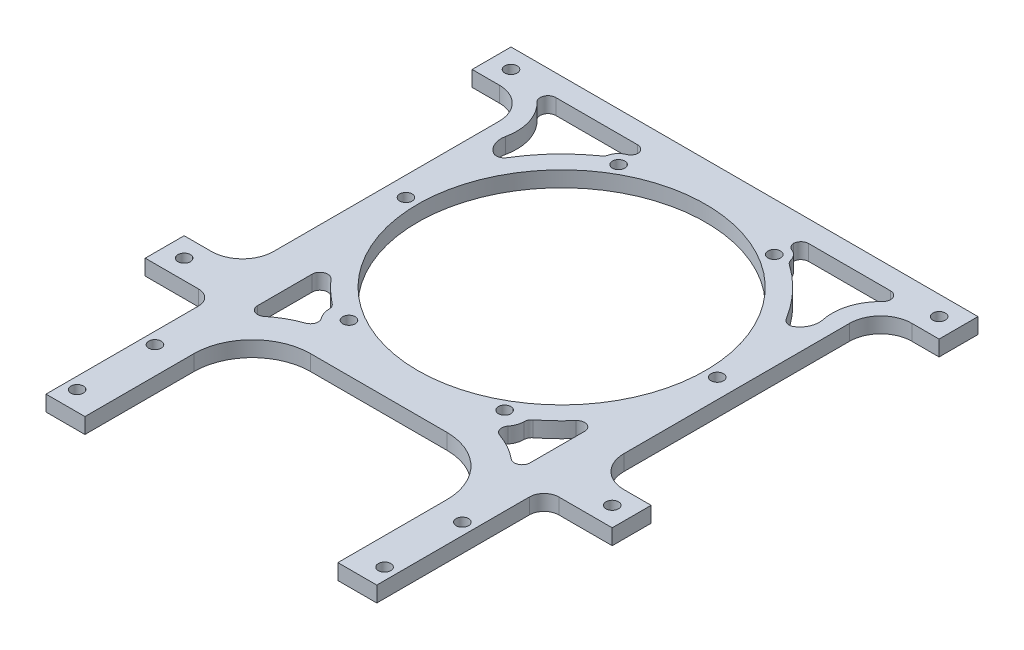
from build123d import *

# Parameters (mm, degrees)
SKETCH_1_W          = 120
SKETCH_1_H          = 94
SKETCH_1_R          = 37
EXTRUDE_2_DEPTH     = 4
SKETCH_2_W          = 15
SKETCH_2_H          = 74
CUT_EXTRUDE_1_DEPTH = 10
FILLET_1_R          = 8
FILLET_2_R          = 8
SKETCH_5_R          = 1.6
CUT_EXTRUDE_2_DEPTH = 10
SKETCH_6_W          = 10
SKETCH_6_H          = 43
EXTRUDE_3_DEPTH     = 4
FILLET_3_R          = 3.8
FILLET_4_R          = 15
SKETCH_7_R          = 1.6
CUT_EXTRUDE_3_DEPTH = 109.240473022
CUT_EXTRUDE_4_DEPTH = 10
FILLET_5_DEPTH      = 4
FILLET_6_R          = 5
MIRROR_1_DEPTH      = 4
SKETCH_10_R         = 1.6
CUT_EXTRUDE_6_DEPTH = 109.240473022


with BuildPart() as part:
    # 草图1 → 凸台-拉伸2 (new body)
    with BuildSketch(Plane(origin=(0, 0, 0), x_dir=(1, 0, 0), z_dir=(0, 1, 0))):
        Rectangle(SKETCH_1_W, SKETCH_1_H)
        with Locations(Location((0, 0, 0), (0, 0, 270))):
            Circle(SKETCH_1_R, mode=Mode.SUBTRACT)
    extrude(amount=EXTRUDE_2_DEPTH)

    # 草图2 → 切除-拉伸1 (cut)
    with BuildSketch(Plane(origin=(0, 4, 0), x_dir=(1, 0, 0), z_dir=(0, 1, 0))):
        with Locations((-52.5, 0)):
            Rectangle(SKETCH_2_W, SKETCH_2_H)
        with Locations((52.5, 0)):
            Rectangle(SKETCH_2_W, SKETCH_2_H)
    extrude(amount=-CUT_EXTRUDE_1_DEPTH, mode=Mode.SUBTRACT)

    # 圆角1
    fillet_1_edges = [part.edges().sort_by_distance(p)[0] for p in [
        (-45, 2, -37),
        (45, 2, -37),
    ]]
    fillet(fillet_1_edges, radius=FILLET_1_R)

    # 圆角2
    fillet_2_edges = [part.edges().sort_by_distance(p)[0] for p in [
        (-45, 2, 37),
        (45, 2, 37),
    ]]
    fillet(fillet_2_edges, radius=FILLET_2_R)

    # 草图5 → 切除-拉伸2 (cut)
    with BuildSketch(Plane(origin=(0, 4, 0), x_dir=(1, 0, 0), z_dir=(0, 1, 0))):
        with Locations(Location((-55, 42, 0), (0, 0, 270))):
            Circle(SKETCH_5_R)
        with Locations(Location((-55, -42, 0), (0, 0, 270))):
            Circle(SKETCH_5_R)
        with Locations(Location((55, -42, 0), (0, 0, 270))):
            Circle(SKETCH_5_R)
        with Locations(Location((55, 42, 0), (0, 0, 270))):
            Circle(SKETCH_5_R)
    extrude(amount=-CUT_EXTRUDE_2_DEPTH, mode=Mode.SUBTRACT)

    # 草图6 → 凸台-拉伸3 (add)
    with BuildSketch(Plane(origin=(0, 4, 0), x_dir=(1, 0, 0), z_dir=(0, 1, 0))):
        with Locations((-37.5, -68.5)):
            Rectangle(SKETCH_6_W, SKETCH_6_H)
        with Locations((37.5, -68.5)):
            Rectangle(SKETCH_6_W, SKETCH_6_H)
    extrude(amount=-EXTRUDE_3_DEPTH)

    # 圆角3
    fillet_3_edges = [part.edges().sort_by_distance(p)[0] for p in [
        (-42.5, 2, 47),
        (42.5, 2, 47),
    ]]
    fillet(fillet_3_edges, radius=FILLET_3_R)

    # 圆角4
    fillet_4_edges = [part.edges().sort_by_distance(p)[0] for p in [
        (-32.5, 2, 47),
        (32.5, 2, 47),
    ]]
    fillet(fillet_4_edges, radius=FILLET_4_R)

    # 草图7 → 切除-拉伸3 (cut, through all)
    with BuildSketch(Plane(origin=(0, 4, 0), x_dir=(1, 0, 0), z_dir=(0, 1, 0))):
        with Locations(Location((-20, 34.641016151, 0), (0, 0, 270))):
            Circle(SKETCH_7_R)
        with Locations(Location((20, 34.641016151, 0), (0, 0, 270))):
            Circle(SKETCH_7_R)
        with Locations(Location((40, 0, 0), (0, 0, 270))):
            Circle(SKETCH_7_R)
        with Locations(Location((20, -34.641016151, 0), (0, 0, 270))):
            Circle(SKETCH_7_R)
        with Locations(Location((-20, -34.641016151, 0), (0, 0, 270))):
            Circle(SKETCH_7_R)
        with Locations(Location((-40, 0, 0), (0, 0, 270))):
            Circle(SKETCH_7_R)
    extrude(amount=-CUT_EXTRUDE_3_DEPTH, mode=Mode.SUBTRACT)

    # 草图8 → 切除-拉伸4 (cut)
    with BuildSketch(Plane(origin=(0, 4, 0), x_dir=(1, 0, 0), z_dir=(0, 1, 0))):
        with BuildLine():
            Line((-20, 41.5), (-53, 41.5))
            ThreePointArc((-53, 41.5), (-42.247051947, 35.373704431), (-42.034221976, 22.999857308))
            Line((-42.034221976, 22.999857308), (-36.845014161, 20.160479446))
            ThreePointArc((-36.845014161, 20.160479446), (-31.047174279, 28.285561145), (-23.495769227, 34.813055431))
            ThreePointArc((-23.495769227, 34.813055431), (-22.413282259, 37.175985331), (-20, 38.141016151))
            Line((-20, 38.141016151), (-20, 41.5))
        make_face()
        with BuildLine():
            ThreePointArc((-24.974500131, -33.76794846), (-30.447809443, -28.929758038), (-35, -23.216373532))
            Line((-35, -23.216373532), (-35, -47.981599748))
            ThreePointArc((-35, -47.981599748), (-28.117207257, -42.250558092), (-19.540408864, -39.670596128))
            ThreePointArc((-19.540408864, -39.670596128), (-23.715698209, -38.061759575), (-24.974500131, -33.76794846))
        make_face()
    extrude(amount=-CUT_EXTRUDE_4_DEPTH, mode=Mode.SUBTRACT)

    # 圆角5: read off the stored shape, not the designer's step
    # 圆角5 outline → 圆角5 (add)
    with BuildSketch(Plane(origin=(0, 0, 0), x_dir=(1, 0, 0), z_dir=(0, 1, 0))):
        with BuildLine():
            ThreePointArc((-19.540408738, -39.670596116), (-22.017157734, -39.271240058), (-23.996197034, -37.729431281))
            ThreePointArc((-23.996197034, -37.729431281), (-23.660968385, -39.520217427), (-24.917103069, -40.839845755))
            ThreePointArc((-24.917103069, -40.839845755), (-22.264757976, -40.089668486), (-19.540408738, -39.670596116))
        make_face()
        with BuildLine():
            ThreePointArc((-25.820706479, -33.125384782), (-25.257029121, -33.817171884), (-25.050340682, -34.685262575))
            ThreePointArc((-25.050340682, -34.685262575), (-25.033361166, -34.224874204), (-24.974500131, -33.76794846))
            ThreePointArc((-24.974500131, -33.76794846), (-25.399635345, -33.449342659), (-25.820706479, -33.125384782))
        make_face()
        with BuildLine():
            ThreePointArc((-35, -47.981599748), (-33.451395129, -46.241873872), (-31.730675246, -44.672177642))
            ThreePointArc((-31.730675246, -44.672177642), (-33.854795441, -44.934725986), (-35, -43.12659857))
            Line((-35, -43.12659857), (-35, -47.981599748))
        make_face()
        with BuildLine():
            ThreePointArc((-35, -29.103264422), (-33.707106781, -27.232435728), (-31.5, -27.780388766))
            ThreePointArc((-31.5, -27.780388766), (-33.328217156, -25.55836343), (-35, -23.216373532))
            Line((-35, -23.216373532), (-35, -29.103264422))
        make_face()
        with BuildLine():
            Line((-20, 41.5), (-22, 41.5))
            ThreePointArc((-22, 41.5), (-20.633341947, 40.960221136), (-20.004377025, 39.632245767))
            ThreePointArc((-20.004377025, 39.632245767), (-20.386776912, 38.582327726), (-21.272727273, 37.901409577))
            ThreePointArc((-21.272727273, 37.901409577), (-20.647542667, 38.080592941), (-20, 38.141016151))
            Line((-20, 38.141016151), (-20, 41.5))
        make_face()
        with BuildLine():
            ThreePointArc((-44.379310345, 38.051724138), (-44.856953382, 40.242781353), (-43, 41.5))
            Line((-43, 41.5), (-53, 41.5))
            ThreePointArc((-53, 41.5), (-48.357616546, 40.605958636), (-44.379310345, 38.051724138))
        make_face()
        with BuildLine():
            ThreePointArc((-23.495769227, 34.813055431), (-23.462294071, 35.153382983), (-23.395766463, 35.488819274))
            ThreePointArc((-23.395766463, 35.488819274), (-23.686578053, 34.842467526), (-24.184558784, 34.338129192))
            ThreePointArc((-24.184558784, 34.338129192), (-23.841346618, 34.577307464), (-23.495769227, 34.813055431))
        make_face()
        with BuildLine():
            ThreePointArc((-35.890546019, 21.814415107), (-37.081603023, 20.921446591), (-38.55964247, 21.098672295))
            Line((-38.55964247, 21.098672295), (-36.845014161, 20.160479446))
            ThreePointArc((-36.845014161, 20.160479446), (-36.377181096, 20.992872494), (-35.890546019, 21.814415107))
        make_face()
    extrude(amount=FILLET_5_DEPTH)

    # 圆角6
    # the kernel refuses this fillet: 5 mm, written as the material it adds along each edge
    with BuildSketch(Plane(origin=(-42.034221976, 4, -22.999857308), x_dir=(0.8772622419285397, 0, 0.48001141537104314), z_dir=(0, -1, 0))) as fillet_6_piece_1:
        with BuildLine():
            CenterArc((4.273425175, -4.99021121), FILLET_6_R, 93.585816178, 69.846074329)
            ThreePointArc((-0.518982018, -3.564436578), (-0.130425942, -1.801010165), (0, 0))
            Line((0, 0), (3.960707916, 0))
        make_face()
    extrude(amount=4)

    # 镜向1: read off the stored shape, not the designer's step
    # 镜向1 outline → 镜向1 (cut)
    with BuildSketch(Plane(origin=(0, 0, 0), x_dir=(1, 0, 0), z_dir=(0, 1, 0))):
        with BuildLine():
            ThreePointArc((31.5, -27.780388766), (28.78468505, -30.584994795), (25.820706479, -33.125384782))
            ThreePointArc((25.820706479, -33.125384782), (25.257029121, -33.817171884), (25.050340682, -34.685262575))
            ThreePointArc((25.050340682, -34.685262575), (24.77249431, -36.293649447), (23.996197034, -37.729431281))
            ThreePointArc((23.996197034, -37.729431281), (23.660968385, -39.520217427), (24.917103069, -40.839845755))
            ThreePointArc((24.917103069, -40.839845755), (28.492191247, -42.456784369), (31.730675246, -44.672177642))
            ThreePointArc((31.730675246, -44.672177642), (33.854795441, -44.934725986), (35, -43.12659857))
            Line((35, -43.12659857), (35, -29.103264422))
            ThreePointArc((35, -29.103264422), (33.707106781, -27.232435728), (31.5, -27.780388766))
        make_face()
        with BuildLine():
            ThreePointArc((24.184558784, 34.338129192), (30.683308295, 28.679863879), (35.890546019, 21.814415107))
            ThreePointArc((35.890546019, 21.814415107), (37.081603023, 20.921446591), (38.55964247, 21.098672295))
            ThreePointArc((38.55964247, 21.098672295), (40.499095767, 23.388308225), (40.778535058, 26.375920225))
            ThreePointArc((40.778535058, 26.375920225), (41.05512866, 32.683754699), (44.379310345, 38.051724138))
            ThreePointArc((44.379310345, 38.051724138), (44.856953382, 40.242781353), (43, 41.5))
            Line((43, 41.5), (22, 41.5))
            ThreePointArc((22, 41.5), (20.633341947, 40.960221136), (20.004377025, 39.632245767))
            ThreePointArc((20.004377025, 39.632245767), (20.386776912, 38.582327726), (21.272727273, 37.901409577))
            ThreePointArc((21.272727273, 37.901409577), (22.627519064, 36.953189062), (23.395766462, 35.488819274))
            ThreePointArc((23.395766462, 35.488819274), (23.686578053, 34.842467526), (24.184558784, 34.338129192))
        make_face()
    extrude(amount=MIRROR_1_DEPTH, mode=Mode.SUBTRACT)

    # 草图10 → 切除-拉伸6 (cut, through all)
    with BuildSketch(Plane(origin=(0, 4, 0), x_dir=(1, 0, 0), z_dir=(0, 1, 0))):
        with Locations(Location((-39.5, -85, 0), (0, 0, 270))):
            Circle(SKETCH_10_R)
        with Locations(Location((-39.5, -65, 0), (0, 0, 270))):
            Circle(SKETCH_10_R)
        with Locations(Location((39.5, -65, 0), (0, 0, 90))):
            Circle(SKETCH_10_R)
        with Locations(Location((39.5, -85, 0), (0, 0, 90))):
            Circle(SKETCH_10_R)
    extrude(amount=-CUT_EXTRUDE_6_DEPTH, mode=Mode.SUBTRACT)


solid = part.part
